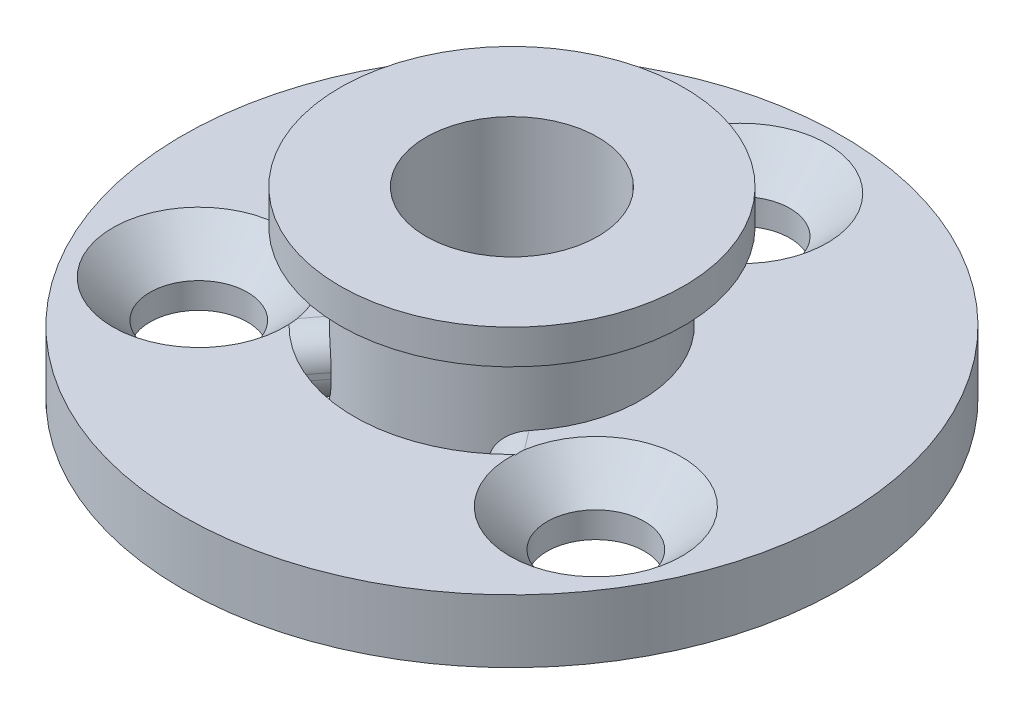
from build123d import *

# Parameters (mm, degrees)
CSK_FOR_M3_FLAT_HEAD_MACHINE_SCREW1_AT_2_COUNT = 2
CSK_FOR_M3_FLAT_HEAD_MACHINE_SCREW1_AT_2_PITCH = 13.856406460551039
CSK_FOR_M3_FLAT_HEAD_MACHINE_SCREW1_AT_3_COUNT = 2
CSK_FOR_M3_FLAT_HEAD_MACHINE_SCREW1_AT_3_PITCH = 13.856406460550982
ENL_V_MAT_EXTRU_1_DEPTH                        = 17.797023545854785
CONG_1_R                                       = 1


with BuildPart() as part:
    # Esquisse1 → Révolution1 (revolve)
    with BuildSketch(Plane.XY, mode=Mode.PRIVATE) as r_volution1_sk:
        Polygon((2.9999999999999996, -3.2), (2.9999999999999996, 3.2), (5.999999999999998, 3.2), (5.999999999999998, 2), (4.499999999999998, 2), (4.5, -1), (11.500000000000002, -1), (11.500000000000002, -3.2), align=None)
    revolve(r_volution1_sk.sketch.rotate(Axis((0, 4.689873417721518, 0), (0, -1, 0)), 90), axis=Axis((0, 4.689873417721518, 0), (0, -1, 0)))

    # Esquisse4 → CSK for M3 Flat Head Machine Screw1 (revolve, cut)
    with BuildSketch(Plane(origin=(-6.928203230275546, -1, 3.999999999999936), x_dir=(0, 0, 1), z_dir=(1, 0, 0))):
        Polygon((0, 0), (-5.4e-16, 2.2), (1.6999999999999995, 2.2), (1.6999999999999997, 1.3000000000000007), (3, 0), align=None)
    csk_for_m3_flat_head_machine_screw1 = revolve(axis=Axis((-6.928203230275546, 5.349999999999991, 3.999999999999936), (0, -1, 0)), mode=Mode.SUBTRACT)

    # CSK for M3 Flat Head Machine Screw1 at 2: CSK for M3 Flat Head Machine Screw1 ×2
    with Locations(*[(i * CSK_FOR_M3_FLAT_HEAD_MACHINE_SCREW1_AT_2_PITCH, 0, 0) for i in range(1, CSK_FOR_M3_FLAT_HEAD_MACHINE_SCREW1_AT_2_COUNT)]):
        add(csk_for_m3_flat_head_machine_screw1, mode=Mode.SUBTRACT)

    # CSK for M3 Flat Head Machine Screw1 at 3: CSK for M3 Flat Head Machine Screw1 ×2
    with Locations(*[Vector(0.5000000000000041, 0, -0.8660254037844364) * (i * CSK_FOR_M3_FLAT_HEAD_MACHINE_SCREW1_AT_3_PITCH) for i in range(1, CSK_FOR_M3_FLAT_HEAD_MACHINE_SCREW1_AT_3_COUNT)]):
        add(csk_for_m3_flat_head_machine_screw1, mode=Mode.SUBTRACT)

    # Esquisse6 → Enlèv. mat.-Extru.1 (cut, through all)
    with BuildSketch(Plane(origin=(0, -1, 0), x_dir=(1, 0, 0), z_dir=(0, 1, 0))):
        with BuildLine():
            Line((2.739426430539251, -3.5700900313105515), (3.348187859547974, -4.363443371601785))
            ThreePointArc((3.348187859547974, -4.363443371601785), (2.78e-15, -5.5), (-3.3481878595479704, -4.363443371601789))
            Line((-3.3481878595479704, -4.363443371601789), (-2.7394264305392486, -3.5700900313105546))
            ThreePointArc((-2.7394264305392486, -3.5700900313105546), (2.27e-15, -4.499999999999999), (2.739426430539251, -3.5700900313105515))
        make_face()
    extrude(amount=-ENL_V_MAT_EXTRU_1_DEPTH, mode=Mode.SUBTRACT)

    # Congé1
    # the kernel refuses this fillet: 1 mm, written as the material it takes off along each edge
    with BuildSketch(Plane(origin=(4.870091432069782, -3.2, 6.346826722329871), x_dir=(0.7933533402912335, 0, -0.608761429008723), z_dir=(-0.608761429008723, 0, -0.7933533402912334))) as cong_1_piece_1_section:
        with BuildLine():
            CenterArc((CONG_1_R, -CONG_1_R), CONG_1_R, 90, 90)
            Line((0, -CONG_1_R), (0, 0))
            Line((0, 0), (CONG_1_R, 0))
        make_face()
    cong_1_piece_1 = extrude(amount=6.0000000000000036, mode=Mode.PRIVATE)
    cong_1_piece_1 = cong_1_piece_1 - Plane(origin=(-8.9e-16, -2.973934992670689, -7.55e-15), x_dir=(-0.6087614290087209, 0, 0.7933533402912349), z_dir=(0, 1, 0)) * Cylinder(4.500000000000007, 17, mode=Mode.PRIVATE)
    cong_1_piece_1 = cong_1_piece_1 & Plane(origin=(-4.4e-16, -2.973934992670689, -1.78e-15), x_dir=(0.6087614290087225, 0, 0.7933533402912338), z_dir=(0, 1, 0)) * Cylinder(5.500000000000003, 17, mode=Mode.PRIVATE)
    add(cong_1_piece_1, mode=Mode.SUBTRACT)
    with BuildSketch(Plane(origin=(-1.2175228580174442, -3.2, 1.586706680582469), x_dir=(-0.7933533402912343, 0, -0.608761429008722), z_dir=(-0.6087614290087219, 0, 0.7933533402912343))) as cong_1_piece_2_section:
        with BuildLine():
            CenterArc((CONG_1_R, -CONG_1_R), CONG_1_R, 90, 90)
            Line((-9e-17, -CONG_1_R), (0, 0))
            Line((0, 0), (CONG_1_R, 0))
        make_face()
    cong_1_piece_2 = extrude(amount=6, mode=Mode.PRIVATE)
    cong_1_piece_2 = cong_1_piece_2 - Plane(origin=(-8.9e-16, -2.973934929539706, -7.55e-15), x_dir=(-0.6087614290087209, 0, 0.7933533402912349), z_dir=(0, 1, 0)) * Cylinder(4.500000000000007, 16, mode=Mode.PRIVATE)
    cong_1_piece_2 = cong_1_piece_2 & Plane(origin=(-4.4e-16, -2.973934929539706, -1.78e-15), x_dir=(0.6087614290087225, 0, 0.7933533402912338), z_dir=(0, 1, 0)) * Cylinder(5.500000000000003, 16, mode=Mode.PRIVATE)
    add(cong_1_piece_2, mode=Mode.SUBTRACT)
    with BuildSketch(Plane(origin=(-4.870091432069775, -1, 6.346826722329874), x_dir=(0, -1, 0), z_dir=(0.6087614290087219, 0, -0.7933533402912343))) as cong_1_piece_3_section:
        with BuildLine():
            CenterArc((CONG_1_R, CONG_1_R), CONG_1_R, 180.00000000000003, 90)
            Line((0, CONG_1_R), (0, 0))
            Line((0, 0), (CONG_1_R, 0))
        make_face()
    cong_1_piece_3 = extrude(amount=6, mode=Mode.PRIVATE)
    cong_1_piece_3 = cong_1_piece_3 - Plane(origin=(-8.9e-16, -1.2260647234530146, -7.55e-15), x_dir=(-0.6087614290087209, 0, 0.7933533402912349), z_dir=(0, 1, 0)) * Cylinder(4.500000000000007, 16, mode=Mode.PRIVATE)
    cong_1_piece_3 = cong_1_piece_3 & Plane(origin=(-4.4e-16, -1.2260647234530146, -1.78e-15), x_dir=(0.6087614290087225, 0, 0.7933533402912338), z_dir=(0, 1, 0)) * Cylinder(5.500000000000003, 16, mode=Mode.PRIVATE)
    add(cong_1_piece_3, mode=Mode.SUBTRACT)
    with BuildSketch(Plane(origin=(1.2175228580174433, -1, 1.586706680582468), x_dir=(2.1e-16, -1, -1.6e-16), z_dir=(0.608761429008723, 0, 0.7933533402912334))) as cong_1_piece_4_section:
        with BuildLine():
            CenterArc((CONG_1_R, CONG_1_R), CONG_1_R, 180, 90)
            Line((2.7e-16, CONG_1_R), (0, 0))
            Line((0, 0), (CONG_1_R, 0))
        make_face()
    cong_1_piece_4 = extrude(amount=6, mode=Mode.PRIVATE)
    cong_1_piece_4 = cong_1_piece_4 - Plane(origin=(-8.9e-16, -1.226064411710552, -7.55e-15), x_dir=(-0.6087614290087209, 0, 0.7933533402912349), z_dir=(0, 1, 0)) * Cylinder(4.500000000000007, 16, mode=Mode.PRIVATE)
    cong_1_piece_4 = cong_1_piece_4 & Plane(origin=(-4.4e-16, -1.226064411710552, -1.78e-15), x_dir=(0.6087614290087225, 0, 0.7933533402912338), z_dir=(0, 1, 0)) * Cylinder(5.500000000000003, 16, mode=Mode.PRIVATE)
    add(cong_1_piece_4, mode=Mode.SUBTRACT)


solid = part.part
